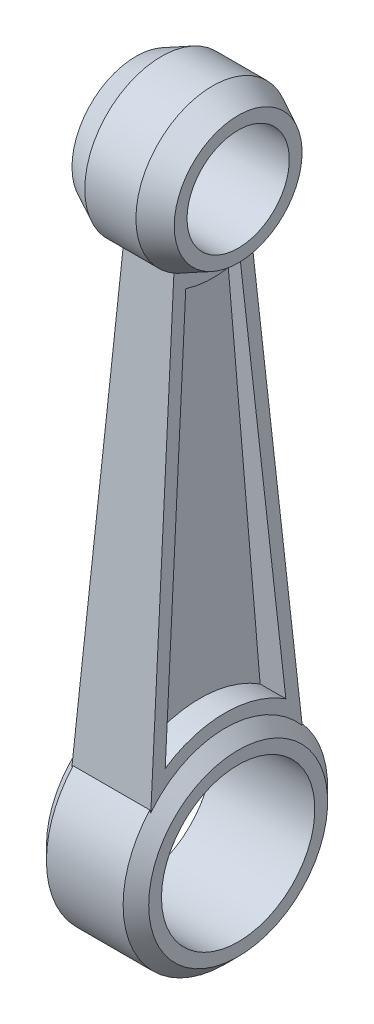
from build123d import *

# Parameters (mm, degrees)
BOSS_EXTRU_1_START      = -2.0000001
BOSS_EXTRU_1_DEPTH      = 2.0000001
BOSS_EXTRU_1_START_2    = 2.0000001
BOSS_EXTRU_1_2_DEPTH    = 1.088880676
BOSS_EXTRU_1_START_3    = 3.256370695
BOSS_EXTRU_1_3_DEPTH    = 1.743629305
BOSS_EXTRU_1_START_4    = 3.172268194
BOSS_EXTRU_1_4_DEPTH    = 0.084102501
ENL_V_MAT_EXTRU_1_DEPTH = 9


with BuildPart() as part:
    # Esquisse2 → Révolution1 (revolve)
    with BuildSketch(Plane.XY, mode=Mode.PRIVATE) as r_volution1_sk:
        Polygon((2.4e-16, 6), (4, 6), (4, 7), (2.9999999999999996, 8), (-1.8e-16, 8), align=None)
    revolve(r_volution1_sk.sketch.rotate(Axis((0, 0, 0), (1, 0, 0)), 90), axis=Axis((0, 0, 0), (1, 0, 0)))



with BuildPart() as body_2:
    # Esquisse3 → Révolution2 (revolve)
    with BuildSketch(Plane.XY, mode=Mode.PRIVATE) as r_volution2_sk:
        Polygon((0, 48.99999999999999), (4.01e-15, 51), (2, 51), (4, 49.99999999999999), (4, 48.99999999999999), align=None)
    revolve(r_volution2_sk.sketch.rotate(Axis((0, 45, 0), (1, 0, 0)), 90), axis=Axis((0, 45, 0), (1, 0, 0)))


with BuildPart() as part_1:
    add(part.part)

    add(body_2.part)  # Boss.-Extru.1 merges body 2
    # Boss.-Extru.1: read off the stored shape, not the designer's step
    # Boss.-Extru.1 outline → Boss.-Extru.1 (add)
    with BuildSketch(Plane.ZY.offset(BOSS_EXTRU_1_START)):
        with BuildLine():
            ThreePointArc((-5.910337632, 5.39146632), (0, 8), (5.910337632, 5.39146632))
            Line((5.910337632, 5.39146632), (3, 39.803847577))
            ThreePointArc((3, 39.803847577), (0, 39), (-3, 39.803847577))
            Line((-3, 39.803847577), (-5.910337632, 5.39146632))
        make_face()
    extrude(amount=BOSS_EXTRU_1_DEPTH)

    # Boss.-Extru.1 2 outline → Boss.-Extru.1 2 (add)
    with BuildSketch(Plane.YZ.offset(BOSS_EXTRU_1_START_2)):
        with BuildLine():
            ThreePointArc((39.803847577, -3), (39, 0), (39.803847577, 3))
            Line((39.803847577, 3), (5.39146632, 5.910337632))
            ThreePointArc((5.39146632, 5.910337632), (8, 0), (5.39146632, -5.910337632))
            Line((5.39146632, -5.910337632), (39.803847577, -3))
        make_face()
    extrude(amount=BOSS_EXTRU_1_2_DEPTH)

    # Boss.-Extru.1 3 outline → Boss.-Extru.1 3 (cut)
    with BuildSketch(Plane(origin=(0, 0, 0), x_dir=(-0.032241294010957995, 0.9994801143396995, 0), z_dir=(0.9994801143396996, 0.032241294010957995, 0)).offset(BOSS_EXTRU_1_START_3)):
        with BuildLine():
            add(Edge.make_bspline(
                [(5.142379796, -5.922750354), (12.17659734275441, -2.94e-15), (5.142379796, 5.922750354)],
                knots=[5.412727934893089, 5.412727934893089, 5.412727934893089, 7.153642679466084, 7.153642679466084, 7.153642679466084], degree=2, weights=[1, 0.6444768969331849, 1]))
            Line((5.142379796, -5.922750354), (39.719507575, -3))
            add(Edge.make_bspline(
                [(39.719507575, -3), (39.4087631690425, -2.4620547166991407), (39.162117173894764, -1.8742292038542891), (38.995705810616975, -1.2534964190781404), (38.91524187122639, -0.6211657082460426), (38.91524187122635, 0.6211657082460548), (38.99570581061705, 1.2534964190781592), (39.16211717389469, 1.8742292038543251), (39.40876316904256, 2.46205471669918), (39.719507575, 3)],
                knots=[3.141592653589793, 3.141592653589793, 3.141592653589793, 3.141592653589793, 3.141592653589793, 3.141592653589793, 3.665191429188086, 3.665191429188086, 3.665191429188086, 3.665191429188086, 4.188790204786387, 4.188790204786387, 4.188790204786387, 4.188790204786387, 4.188790204786387, 4.188790204786387], degree=5, weights=[1, 0.9999999999999991, 0.9995355802743678, 0.9995355802743658, 1.0000000000000004, 0.9999999999999986, 0.9995355802743691, 0.9995355802743657, 1.0000000000000004, 1]))
            Line((39.719507575, 3), (5.142379796, 5.922750354))
        make_face()
    extrude(amount=BOSS_EXTRU_1_3_DEPTH, mode=Mode.SUBTRACT)

    # Boss.-Extru.1 4 outline → Boss.-Extru.1 4 (add)
    with BuildSketch(Plane(origin=(0, 0, 0), x_dir=(-0.032241294010957995, 0.9994801143396995, 0), z_dir=(0.9994801143396996, 0.032241294010957995, 0)).offset(BOSS_EXTRU_1_START_4)):
        with BuildLine():
            add(Edge.make_bspline(
                [(5.142379796, -5.922750354), (12.17659734275441, -2.94e-15), (5.142379796, 5.922750354)],
                knots=[5.412727934893089, 5.412727934893089, 5.412727934893089, 7.153642679466084, 7.153642679466084, 7.153642679466084], degree=2, weights=[1, 0.6444768969331849, 1]))
            Line((5.142379796, -5.922750354), (39.719507575, -3))
            add(Edge.make_bspline(
                [(39.719507575, -3), (39.4087631690425, -2.4620547166991407), (39.162117173894764, -1.8742292038542891), (38.995705810616975, -1.2534964190781404), (38.91524187122639, -0.6211657082460426), (38.91524187122635, 0.6211657082460548), (38.99570581061705, 1.2534964190781592), (39.16211717389469, 1.8742292038543251), (39.40876316904256, 2.46205471669918), (39.719507575, 3)],
                knots=[3.141592653589793, 3.141592653589793, 3.141592653589793, 3.141592653589793, 3.141592653589793, 3.141592653589793, 3.665191429188086, 3.665191429188086, 3.665191429188086, 3.665191429188086, 4.188790204786387, 4.188790204786387, 4.188790204786387, 4.188790204786387, 4.188790204786387, 4.188790204786387], degree=5, weights=[1, 0.9999999999999991, 0.9995355802743678, 0.9995355802743658, 1.0000000000000004, 0.9999999999999986, 0.9995355802743691, 0.9995355802743657, 1.0000000000000004, 1]))
            Line((39.719507575, 3), (5.142379796, 5.922750354))
        make_face()
    extrude(amount=BOSS_EXTRU_1_4_DEPTH)

    # Esquisse6 → Enlèv. mat.-Extru.1 (cut)
    with BuildSketch(Plane(origin=(10, 0, 0), x_dir=(0, 0, -1), z_dir=(1, 0, 0))):
        with BuildLine():
            Line((4.7185213239125305, 7.617327682628814), (2.121151849996758, 38.329114389434075))
            ThreePointArc((2.121151849996758, 38.329114389434075), (1.0732662125583343, 38.082767920838506), (1.29e-15, 37.999999999999986))
            ThreePointArc((1.29e-15, 37.999999999999986), (-1.0732662125583345, 38.08276792083852), (-2.12115184999676, 38.32911438943409))
            Line((-2.12115184999676, 38.32911438943409), (-4.7185213239117045, 7.617327682628745))
            add(Edge.make_bspline(
                [(-4.7185213239117045, 7.617327682628745), (-4.011984255343939, 8.070257956932029), (-3.261550361542695, 8.410740591888102), (-2.2711967086518885, 8.702341470829111), (-2.0704598676815316, 8.75383204519997), (-1.6635130029960632, 8.842792898029453), (-1.456446032141917, 8.880350619711338), (-0.8364313606849374, 8.969908948596256), (-0.00941084225722518, 9.029205401703816), (0.818259414860091, 8.971660679545408), (1.646265253396883, 8.853769039344968), (2.0556953800959668, 8.76494999754429), (2.850690444417165, 8.532525136333405), (3.23863975479659, 8.388601680371798), (3.9952504696443585, 8.044777052176354), (4.365252036804486, 7.8437933023834185), (4.7185213239125305, 7.617327682628814)],
                knots=[0, 0, 0, 0, 0.24999999999999978, 0.24999999999999978, 0.31249999999999983, 0.31249999999999983, 0.3749999999999999, 0.3749999999999999, 0.4999999999999999, 0.6249999999999999, 0.6249999999999999, 0.7499999999999999, 0.7499999999999999, 0.8749999999999999, 0.8749999999999999, 1, 1, 1, 1], degree=3))
        make_face()
    extrude(amount=-ENL_V_MAT_EXTRU_1_DEPTH, mode=Mode.SUBTRACT)

    # Symétrie10: part across plane


with BuildPart() as part_2:
    add(part_1.part)
    add(part_1.part.mirror(Plane(origin=(0, 0, 0), x_dir=(0, 0, 1), z_dir=(1, 0, 0))))


solid = part_2.part
